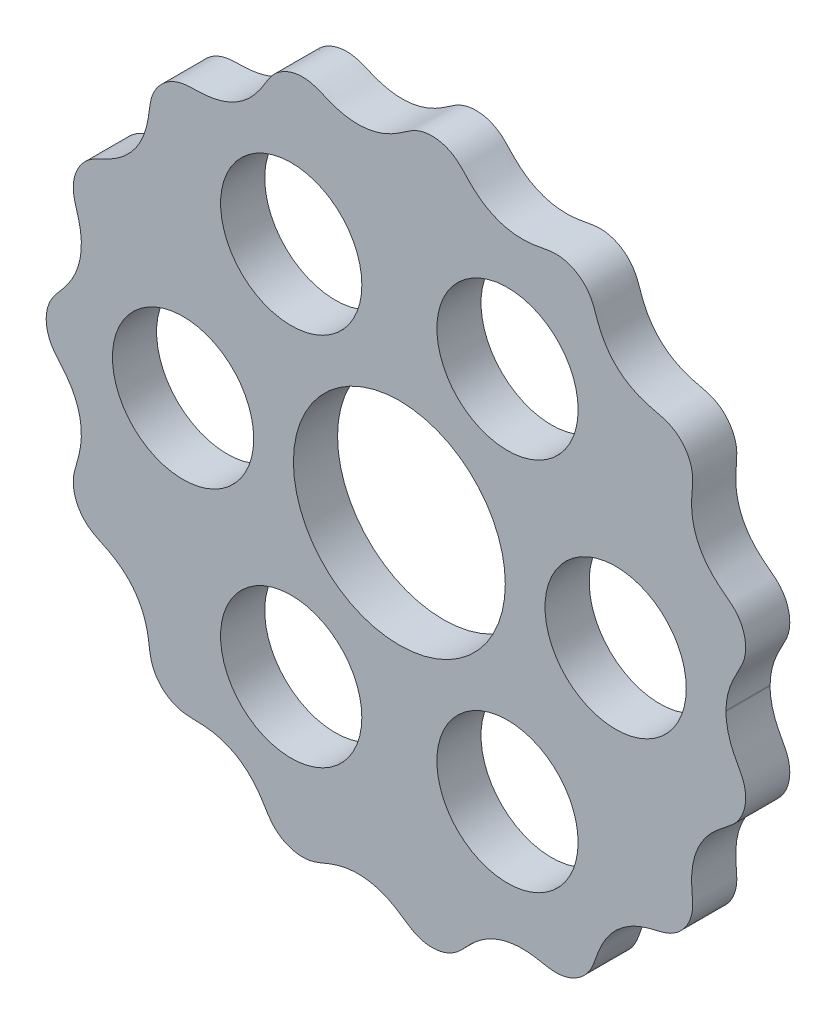
from build123d import *

# Parameters (mm, degrees)
BOSS_EXTRUDE1_DEPTH = 5
SKETCH2_R           = 12
SKETCH2_R_2         = 8
CUT_EXTRUDE1_DEPTH  = 57.653596622


# Read off the part's stored shape, not the designer's step: Boss-Extrude1
with BuildPart() as part:
    # Boss-Extrude1 outline → Boss-Extrude1 (new body)
    with BuildSketch(Plane.XY):
        with BuildLine():
            Line((36.998722033, -0.001054281), (36.99954865, 0.112257386))
            add(Edge.make_bspline(
                [(36.99954865, 0.112257386), (37.000270367, 0.161831196), (37.002853756, 0.261309148), (37.011083739, 0.475612896), (37.027751866, 0.686060064), (37.057401299, 0.973781963), (37.106377226, 1.31810626), (37.171822023, 1.656164832), (37.253267458, 1.993388321), (37.347124748, 2.325846439), (37.452941361, 2.655441957), (37.593357547, 3.033759794), (37.800770534, 3.51967602), (38.063070944, 4.054128866), (38.380004735, 4.635374121), (38.732518387, 5.273630146), (39.046751238, 6.008512211), (39.236640726, 6.858055977), (39.250091521, 7.787066394), (39.053564794, 8.75531068), (38.626208159, 9.732695543), (38.025700448, 10.517383756), (37.328054136, 11.091682662), (36.60811715, 11.629850376), (35.975000223, 12.138034306), (35.152550193, 12.91020298), (34.390673897, 13.870253643), (33.789981735, 14.95868362), (33.378085782, 16.145067451), (33.169373356, 17.154843178), (33.092097624, 18.112108135), (33.108904916, 19.000648259), (33.173614, 19.815733524), (33.238879281, 20.560019274), (33.227987247, 21.380129686), (33.047104395, 22.255228109), (32.664665017, 23.127768358), (32.06507968, 23.941852005), (31.23982104, 24.668864946), (30.167791626, 25.209669724), (29.000711136, 25.434830102), (27.857662069, 25.733478365), (26.84322374, 26.116856655), (25.973167428, 26.568653448), (25.160139265, 27.123784444), (24.422495656, 27.779104005), (23.770727885, 28.523846991), (23.215457794, 29.345954056), (22.792691619, 30.162245603), (22.47390955, 30.945683354), (22.219346682, 31.675325555), (21.987533976, 32.336511026), (21.659745235, 33.038802347), (21.169269169, 33.733285134), (20.490527161, 34.370384852), (19.62184838, 34.886918222), (18.721124416, 35.182924139), (17.841990931, 35.279542311), (17.032588114, 35.215325385), (16.30577961, 35.076867908), (15.510727511, 34.926325841), (14.638426571, 34.811573208), (13.688649268, 34.778978993), (12.671565392, 34.867723121), (11.447844853, 35.135462468), (10.292384973, 35.604508144), (9.244164008, 36.252478247), (8.244380121, 37.098840325), (7.447178549, 37.929698394), (6.674634431, 38.793502658), (5.68309281, 39.41558352), (4.66819347, 39.747034623), (3.692809843, 39.849081483), (2.630366398, 39.734817039), (1.530382972, 39.330180269), (0.594362483, 38.643900587), (-0.359798631, 37.997102241), (-1.301372389, 37.49269138), (-2.206771749, 37.131336425), (-3.161399566, 36.878076), (-4.150113917, 36.746090347), (-5.159112151, 36.741723073), (-6.170393876, 36.868024154), (-7.091417923, 37.098213056), (-7.919228397, 37.39230107), (-8.664576462, 37.704746935), (-9.345935181, 37.990582819), (-10.123662642, 38.220232855), (-11.002600535, 38.307242073), (-11.9445112, 38.204102119), (-12.901325323, 37.878615217), (-13.697734929, 37.395441616), (-14.321962314, 36.816489383), (-14.788333399, 36.196222631), (-15.15271525, 35.596738144), (-15.55423565, 34.935241327), (-16.030244773, 34.234700168), (-16.61524447, 33.523916779), (-17.33141745, 32.835420988), (-18.125443708, 32.24348686), (-18.984145093, 31.7575464), (-19.894861635, 31.385470152), (-20.838888358, 31.12642101), (-21.909595088, 30.963786363), (-23.088125921, 30.910663697), (-24.274994516, 30.932065517), (-25.434031129, 30.62446242), (-26.389157903, 30.085624441), (-27.141333946, 29.416783184), (-27.69727162, 28.643752428), (-28.058710579, 27.822059835), (-28.241105604, 27.01230335), (-28.332549336, 26.255181748), (-28.441352124, 25.435207729), (-28.613815275, 24.559922927), (-28.892199166, 23.643549075), (-29.306598206, 22.709052047), (-29.95580069, 21.642454051), (-30.768114001, 20.708833865), (-31.711629586, 19.931800273), (-32.675790022, 19.349849993), (-33.40030725, 18.98501049), (-34.214746578, 18.609763984), (-35.229470131, 18.07968265), (-36.114733026, 17.200706168), (-36.720075728, 16.030293846), (-36.984206131, 14.73501705), (-36.921436836, 13.540326839), (-36.536844923, 12.419312831), (-36.222064605, 11.285126273), (-36.044759387, 10.218808333), (-35.997118214, 9.243188269), (-36.067290528, 8.262910288), (-36.261191486, 7.295472475), (-36.577234742, 6.355849135), (-37.0088699, 5.458795345), (-37.599558744, 4.532516269), (-38.243938105, 3.735290386), (-38.885916528, 3.033020611), (-39.436551465, 2.254140701), (-39.796055658, 1.48046551), (-40.011497212, 0.573417452), (-40.026612923, -0.437283008), (-39.83543547, -1.364356277), (-39.483345482, -2.1726004), (-39.027053396, -2.841063846), (-38.546053167, -3.400176958), (-38.019306876, -4.011037517), (-37.4839594, -4.705445769), (-36.9799451, -5.507802007), (-36.546140169, -6.427806197), (-36.236329623, -7.387083398), (-36.053781782, -8.367659532), (-35.997037565, -9.354790726), (-36.059079888, -10.329485057), (-36.246239764, -11.38357784), (-36.566424081, -12.493071312), (-36.931379346, -13.597775621), (-36.980703376, -14.770029814), (-36.710370557, -16.057740558), (-36.09410814, -17.230756), (-35.067609609, -18.228819967), (-33.784970318, -18.798452451), (-32.751396611, -19.29632661), (-31.637911457, -19.983115099), (-30.501762392, -20.94144115), (-29.575814047, -22.135732199), (-28.925964108, -23.50281001), (-28.590028762, -24.66344732), (-28.428347132, -25.52966679), (-28.325131449, -26.334004858), (-28.232745376, -27.069385325), (-28.045129505, -27.860973503), (-27.682554734, -28.669502504), (-27.123409006, -29.436271159), (-26.364707126, -30.103880562), (-25.550537644, -30.553425904), (-24.740620095, -30.806480973), (-23.97308253, -30.902740914), (-23.273939358, -30.919490682), (-22.502855754, -30.935753534), (-21.660848761, -30.995699397), (-20.755458968, -31.143633919), (-19.803336359, -31.415038945), (-18.893624774, -31.802079177), (-18.041061706, -32.298846798), (-17.25961325, -32.899231861), (-16.557986937, -33.586951826), (-15.877270869, -34.433905919), (-15.237275543, -35.42990474), (-14.662795523, -36.472993139), (-13.817758148, -37.329214514), (-12.870992683, -37.89144908), (-11.91204679, -38.211565908), (-10.964987774, -38.307049033), (-10.078357726, -38.210724198), (-9.295914268, -37.96984607), (-8.609229525, -37.678839537), (-7.8557317, -37.365570415), (-7.017669629, -37.074469353), (-6.085831103, -36.850873928), (-5.062752273, -36.735276131), (-3.808276519, -36.757214235), (-2.585154279, -36.989126891), (-1.436131485, -37.415006627), (-0.296689553, -38.037508647), (0.643436405, -38.683822821), (1.575687506, -39.355623169), (2.669397264, -39.742606598), (3.723806861, -39.848834564), (4.694097873, -39.740195807), (5.715557522, -39.401367705), (6.720324277, -38.755118722), (7.656439553, -37.683960891), (8.83657926, -36.512961786), (10.161723139, -35.644794212), (11.538286303, -35.108041682), (12.750288343, -34.857416342), (13.745574669, -34.779578069), (14.670794337, -34.816123496), (15.514541118, -34.928897433), (16.279136012, -35.072817118), (16.971564564, -35.205288227), (17.748142508, -35.278608078), (18.600989485, -35.206427359), (19.496372698, -34.940981685), (20.380385726, -34.451026121), (21.088226956, -33.824538987), (21.612792464, -33.119704651), (21.96521667, -32.393866486), (22.209201019, -31.700415058), (22.47336021, -30.940939076), (22.80406093, -30.132196479), (23.243053928, -29.295611883), (23.817496134, -28.460842401), (24.649676677, -27.531606055), (25.809747588, -26.610264213), (27.225978407, -25.902033944), (28.82566442, -25.471890962), (30.216326183, -25.19491269), (31.272650701, -24.645093521), (32.073667779, -23.929645469), (32.650932336, -23.142109086), (33.084816806, -22.173026821), (33.292673149, -21.027507985), (33.173363035, -19.880870911), (33.085925414, -18.739242734), (33.120199423, -17.436854068), (33.33141262, -16.227060355), (33.747552539, -15.052890892), (34.360355928, -13.958928795), (34.973244187, -13.13577506), (35.6329212, -12.444924412), (36.303323804, -11.868151838), (36.949747372, -11.374502376), (37.542926334, -10.926101731), (38.138564068, -10.36834062), (38.661644623, -9.649469585), (39.051622501, -8.775534009), (39.253528668, -7.771627681), (39.232399083, -6.819885719), (39.03171435, -5.963997917), (38.706407116, -5.225345417), (38.348390806, -4.582262366), (38.030274513, -3.994030786), (37.768638219, -3.452599851), (37.563114133, -2.959998795), (37.424791209, -2.576230778), (37.321329499, -2.242346894), (37.245350457, -1.961010862), (37.19102617, -1.734632017), (37.143162747, -1.506409484), (37.101957025, -1.276429983), (37.067473649, -1.048557704), (37.039794321, -0.812504101), (37.021586593, -0.61210125), (37.010300225, -0.444046604), (37.002482905, -0.262758267), (36.999587895, -0.126805105), (36.998720424, -0.051157403), (36.998722033, -0.001054281)],
                knots=[0.069906552, 0.069906552, 0.069906552, 0.069906552, 0.069906552, 0.070662705, 0.071418858, 0.072175011, 0.072931163, 0.074443469, 0.075955774, 0.076711927, 0.07746808, 0.078980385, 0.08049269, 0.082004996, 0.084395977, 0.086786958, 0.08917794, 0.091568921, 0.094847068, 0.098125216, 0.101274746, 0.104424276, 0.108751929, 0.110915756, 0.113079582, 0.116233921, 0.119388259, 0.125696936, 0.129069551, 0.132442167, 0.135814782, 0.139187398, 0.141638114, 0.144088829, 0.146539545, 0.148990261, 0.152358337, 0.155726414, 0.158934823, 0.162143232, 0.166691212, 0.171239193, 0.174449338, 0.177659484, 0.18086963, 0.184079776, 0.187325474, 0.190571172, 0.19381687, 0.197062568, 0.199360109, 0.20165765, 0.203955191, 0.206252732, 0.209495427, 0.212738122, 0.216072123, 0.219406124, 0.221832132, 0.224258141, 0.226684149, 0.229110158, 0.23244866, 0.235787163, 0.239125665, 0.242464168, 0.248842239, 0.252031274, 0.25522031, 0.259595681, 0.263971051, 0.267155181, 0.270339311, 0.273527927, 0.276716543, 0.281098028, 0.285479514, 0.288672977, 0.291866441, 0.295059905, 0.298253368, 0.301587487, 0.304921605, 0.308255723, 0.311589842, 0.314012663, 0.316435485, 0.318858306, 0.321281127, 0.324610812, 0.327940497, 0.331187646, 0.334434795, 0.336735333, 0.339035871, 0.341336408, 0.343636946, 0.346887177, 0.350137408, 0.35338764, 0.356637871, 0.35984345, 0.363049029, 0.366254608, 0.369460188, 0.374002159, 0.37854413, 0.381748168, 0.384952206, 0.388295162, 0.391638118, 0.394139738, 0.396641357, 0.399142977, 0.401644597, 0.404988572, 0.408332548, 0.411676523, 0.415020498, 0.421320268, 0.424470152, 0.427620037, 0.42978082, 0.431941604, 0.436263171, 0.442553477, 0.44575116, 0.448948842, 0.4534821, 0.458015359, 0.461214295, 0.464413231, 0.467612167, 0.470811103, 0.474067915, 0.477324728, 0.48058154, 0.483838353, 0.488448153, 0.490753054, 0.493057954, 0.496311571, 0.499565188, 0.502888593, 0.506211997, 0.508630191, 0.511048385, 0.513466578, 0.515884772, 0.519212512, 0.522540252, 0.525867992, 0.529195732, 0.532395625, 0.535595519, 0.538795412, 0.541995305, 0.546385703, 0.5507761, 0.553971235, 0.55716637, 0.563521587, 0.567888097, 0.572254606, 0.575437202, 0.578619797, 0.584984988, 0.59167472, 0.595019587, 0.598364453, 0.600795097, 0.603225741, 0.605656385, 0.608087029, 0.611427296, 0.614767562, 0.618003803, 0.621240044, 0.623533226, 0.625826408, 0.628119589, 0.630412771, 0.633651874, 0.636890977, 0.640130079, 0.643369182, 0.646585958, 0.649802734, 0.65301951, 0.656236286, 0.66079302, 0.665349754, 0.668564511, 0.671779268, 0.67514097, 0.678502671, 0.680948815, 0.683394958, 0.685841102, 0.688287245, 0.691653534, 0.695019824, 0.698386113, 0.701752402, 0.708074014, 0.711234819, 0.714395625, 0.718732153, 0.723068681, 0.726224574, 0.729380466, 0.732567413, 0.73575436, 0.740272967, 0.744791574, 0.751166985, 0.757542395, 0.760810298, 0.764078201, 0.767346103, 0.770614006, 0.772926291, 0.775238576, 0.777550861, 0.779863146, 0.783127665, 0.786392183, 0.789704968, 0.793017752, 0.795428146, 0.79783854, 0.800248934, 0.802659328, 0.805976281, 0.809293235, 0.812610189, 0.815927142, 0.82228005, 0.828632958, 0.833136991, 0.837641023, 0.840817225, 0.843993427, 0.847160094, 0.850326761, 0.854678316, 0.859029872, 0.862201581, 0.86537329, 0.871716709, 0.875072299, 0.878427889, 0.881783479, 0.88513907, 0.887577489, 0.890015909, 0.892454329, 0.894892749, 0.898243686, 0.901594623, 0.904905775, 0.908216926, 0.910631245, 0.913045564, 0.915459883, 0.917874201, 0.919402492, 0.920930783, 0.922459074, 0.923223219, 0.923987364, 0.92475151, 0.925515655, 0.9262798, 0.927043946, 0.927808091, 0.928572236, 0.928954309, 0.929336382, 0.930100527, 0.930100527, 0.930100527, 0.930100527, 0.930100527], degree=4))
        make_face()
    extrude(amount=BOSS_EXTRUDE1_DEPTH)

    # Sketch2 → Cut-Extrude1 (cut, through all)
    with BuildSketch(Plane.XY.offset(5)):
        Circle(SKETCH2_R)
        with Locations((24.499360993, -0.001054281)):
            Circle(SKETCH2_R_2)
        with Locations((12.248767462, -21.217596137)):
            Circle(SKETCH2_R_2)
        with Locations((-12.250593531, -21.216541856)):
            Circle(SKETCH2_R_2)
        with Locations((-24.499360993, 0.001054281)):
            Circle(SKETCH2_R_2)
        with Locations((-12.248767462, 21.217596137)):
            Circle(SKETCH2_R_2)
        with Locations((12.250593531, 21.216541856)):
            Circle(SKETCH2_R_2)
    extrude(amount=-CUT_EXTRUDE1_DEPTH, mode=Mode.SUBTRACT)


solid = part.part
